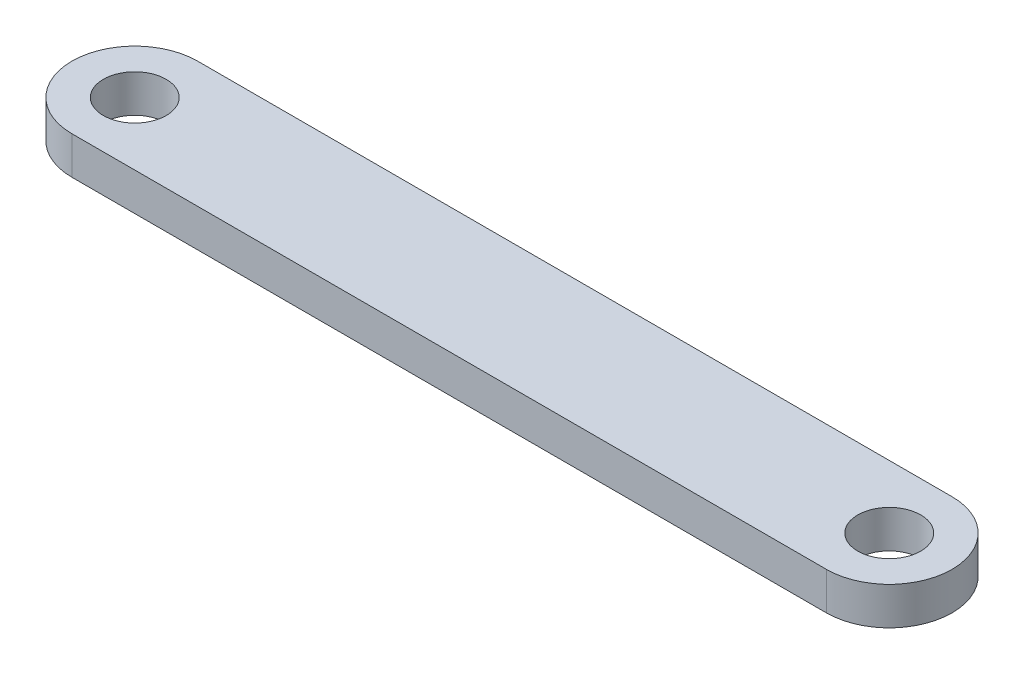
from build123d import *

# Parameters (mm, degrees)
SKETCH1_R           = 3.175
BOSS_EXTRUDE1_DEPTH = 3.81


with BuildPart() as part:
    # Sketch1 → Boss-Extrude1 (new body)
    with BuildSketch(Plane(origin=(0, 0, 0), x_dir=(1, 0, 0), z_dir=(0, 1, 0))):
        with BuildLine():
            Line((-38.1, 6.35), (38.1, 6.35))
            ThreePointArc((38.1, 6.35), (44.45, 0), (38.1, -6.35))
            Line((38.1, -6.35), (-38.1, -6.35))
            ThreePointArc((-38.1, -6.35), (-44.45, 0), (-38.1, 6.35))
        make_face()
        with Locations((-38.1, 0)):
            Circle(SKETCH1_R, mode=Mode.SUBTRACT)
        with Locations((38.1, 0)):
            Circle(SKETCH1_R, mode=Mode.SUBTRACT)
    extrude(amount=BOSS_EXTRUDE1_DEPTH)


solid = part.part
